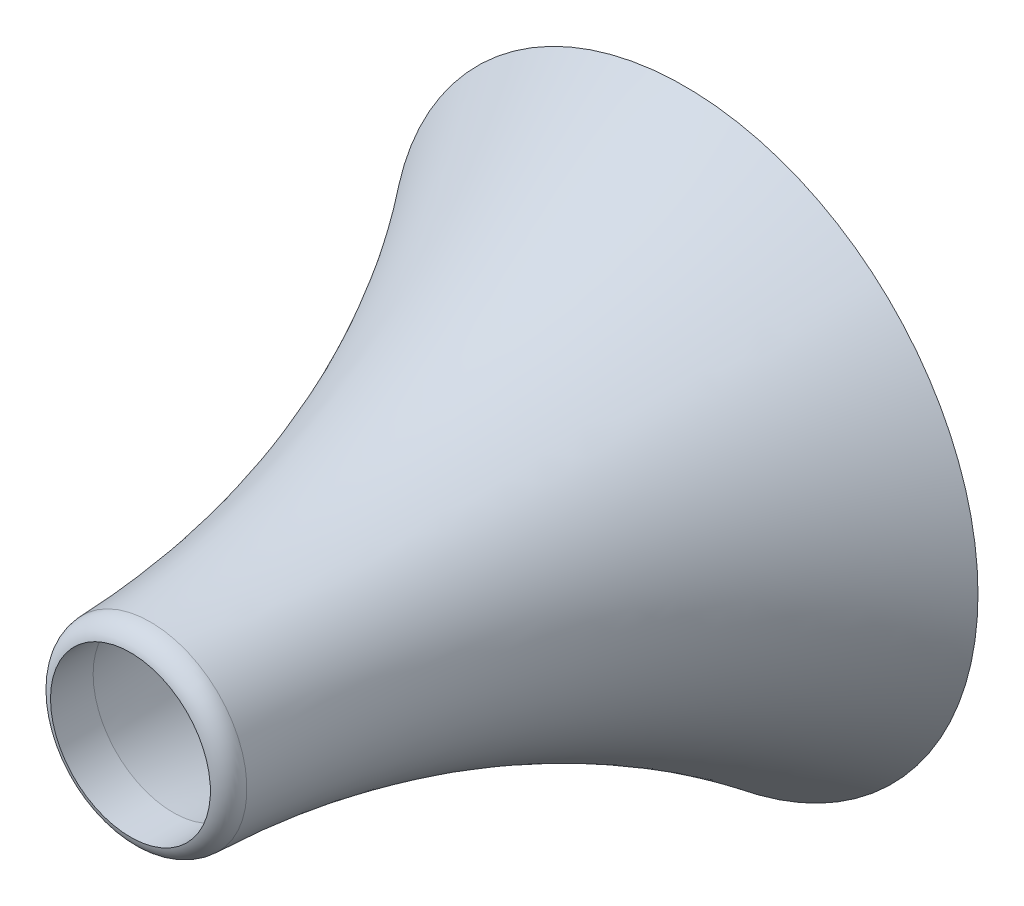
from build123d import *

# Parameters (mm, degrees)
FILLET5_R = 4


with BuildPart() as part:
    # Sketch1 → Revolve2 (revolve)
    with BuildSketch(Plane(origin=(0, 0, 0), x_dir=(1, 0, 0), z_dir=(0, 1, 0))):
        with BuildLine():
            Line((-40, 0), (-55, 0))
            add(Edge.make_bspline(
                [(-55, 0), (-18.745116659, -47.008008668), (-18, -104)],
                knots=[0, 0, 0, 1, 1, 1], degree=2))
            Line((-18, -104), (-15, -104))
            Line((-15, -104), (-15, -96))
            add(Edge.make_bspline(
                [(-48, -4), (-20.124649885, -45.441854427), (-15, -96)],
                knots=[0, 0, 0, 1, 1, 1], degree=2))
            Line((-48, -4), (-40, -4))
            Line((-40, -4), (-40, 0))
        make_face()
    revolve(axis=Axis((0, 0, -34.586839539), (0, 0, 1)))

    # Fillet5
    # the kernel refuses this fillet: 4 mm, written as the material it takes off along each edge
    with BuildSketch(Plane(origin=(0, 0, 104), x_dir=(-1, 0, 0), z_dir=(0, 1, 0))) as fillet5_piece_1:
        with BuildLine():
            CenterArc((14.090452263, -3.895217955), FILLET5_R, 1.940553097, 74.91616861)
            Line((15, 0), (15.018190955, 0.077904359))
            ThreePointArc((15.018190955, 0.077904359), (16.5, 0.08), (18, 0.08))
            Line((18, 0.08), (18.079993164, 0.001045835))
            ThreePointArc((18.079993164, 0.001045835), (18.114283516, -1.87823868), (18.168112379, -3.757058686))
            Line((18.168112379, -3.757058686), (18.088158259, -3.759767691))
        make_face()
    revolve(axis=Axis((0, 0, 104), (0, 0, 1)), mode=Mode.SUBTRACT)


solid = part.part
